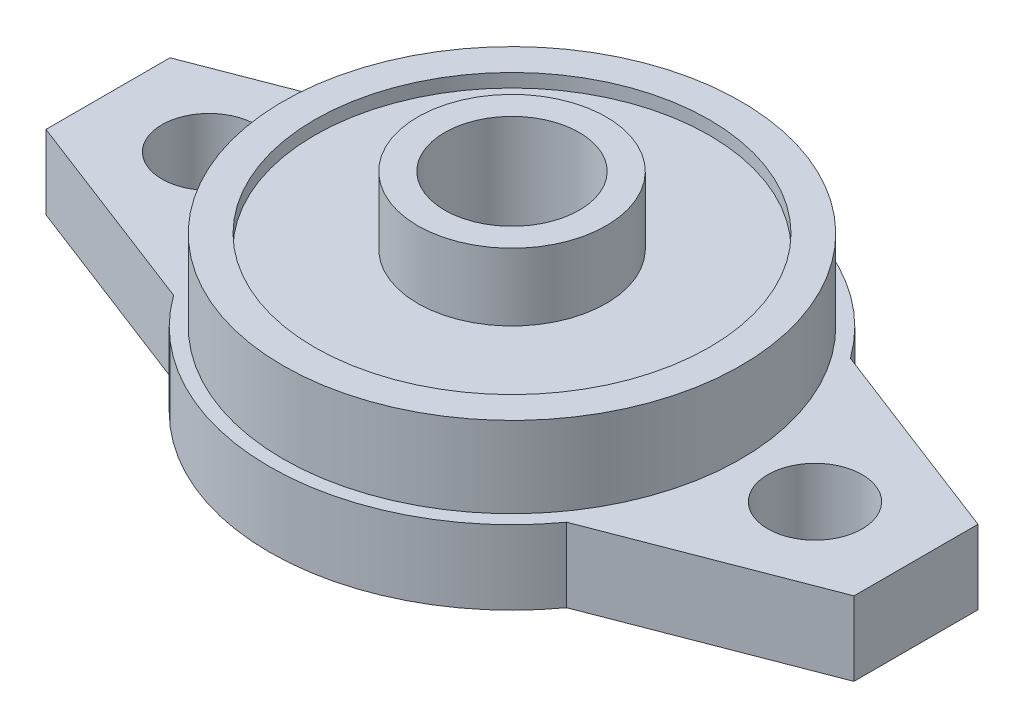
from build123d import *

# Parameters (mm, degrees)
SKETCH_1_R          = 3.5
SKETCH_1_R_2        = 5
EXTRUDE_1_DEPTH     = 5.5
SKETCH_2_R          = 17
SKETCH_2_R_2        = 5
EXTRUDE_2_DEPTH     = 6
SKETCH_3_R          = 7
SKETCH_3_R_2        = 5
EXTRUDE_3_DEPTH     = 4
CUT_EXTRUDE_START   = -1
SKETCH_4_R          = 14.65
SKETCH_4_R_2        = 7
CUT_EXTRUDE_1_DEPTH = 1


with BuildPart() as part:
    # 草图1 → 凸台-拉伸1 (new body)
    with BuildSketch(Plane(origin=(0, 0, 0), x_dir=(1, 0, 0), z_dir=(0, 1, 0))):
        with BuildLine():
            Line((-14.5934987, 10.537067699), (-30, 4.60495562))
            Line((-30, 4.60495562), (-30, -4.60495562))
            Line((-30, -4.60495562), (-14.5934987, -10.537067699))
            ThreePointArc((-14.5934987, -10.537067699), (0, -18), (14.5934987, -10.537067699))
            Line((14.5934987, -10.537067699), (30, -4.60495562))
            Line((30, -4.60495562), (30, 4.60495562))
            Line((30, 4.60495562), (14.5934987, 10.537067699))
            ThreePointArc((14.5934987, 10.537067699), (0, 18), (-14.5934987, 10.537067699))
        make_face()
        with Locations((-22.5, 0)):
            Circle(SKETCH_1_R, mode=Mode.SUBTRACT)
        Circle(SKETCH_1_R_2, mode=Mode.SUBTRACT)
        with Locations((22.5, 0)):
            Circle(SKETCH_1_R, mode=Mode.SUBTRACT)
    extrude(amount=EXTRUDE_1_DEPTH)

    # 草图2 → 凸台-拉伸2 (add)
    with BuildSketch(Plane(origin=(0, 5.5, 0), x_dir=(1, 0, 0), z_dir=(0, 1, 0))):
        Circle(SKETCH_2_R)
        Circle(SKETCH_2_R_2, mode=Mode.SUBTRACT)
    extrude(amount=EXTRUDE_2_DEPTH)

    # 草图3 → 凸台-拉伸3 (add)
    with BuildSketch(Plane(origin=(0, 11.5, 0), x_dir=(1, 0, 0), z_dir=(0, 1, 0))):
        Circle(SKETCH_3_R)
        Circle(SKETCH_3_R_2, mode=Mode.SUBTRACT)
    extrude(amount=EXTRUDE_3_DEPTH)

    # 草图4 → 切除-拉伸1 (cut)
    with BuildSketch(Plane(origin=(0, 11.5, 0), x_dir=(1, 0, 0), z_dir=(0, 1, 0)).offset(CUT_EXTRUDE_START)):
        Circle(SKETCH_4_R)
        Circle(SKETCH_4_R_2, mode=Mode.SUBTRACT)
    extrude(amount=CUT_EXTRUDE_1_DEPTH, mode=Mode.SUBTRACT)


solid = part.part
